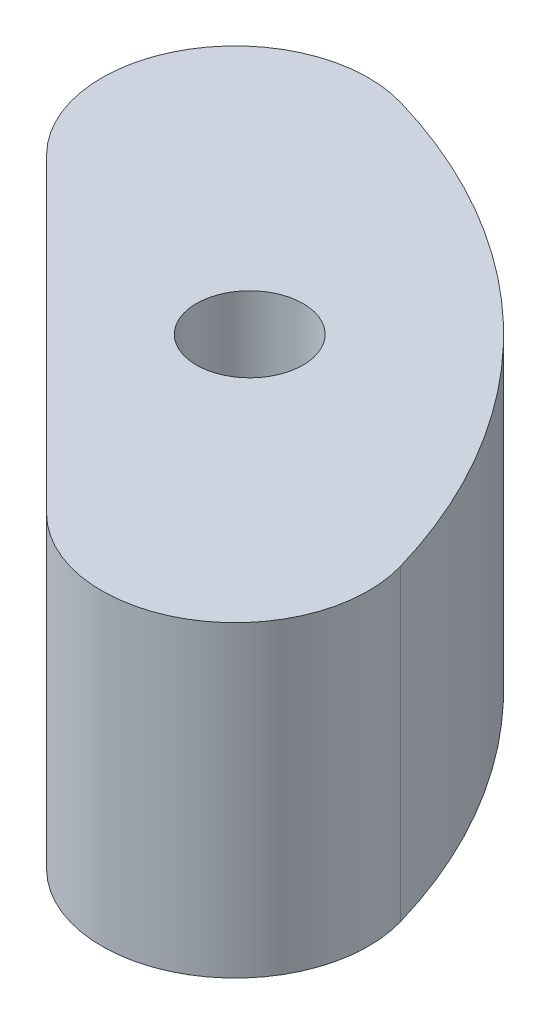
from build123d import *

# Parameters (mm, degrees)
SKETCH2_R           = 3.302
BOSS_EXTRUDE2_DEPTH = 9.525
SKETCH4_R           = 1.950000037
CUT_EXTRUDE2_DEPTH  = 5.800000084
FILLET1_R           = 8.255


with BuildPart() as part:
    # Sketch2 → Boss-Extrude2 (new, symmetric)
    with BuildSketch(Plane(origin=(0, 0, 0), x_dir=(1, 0, 0), z_dir=(0, 1, 0))):
        with BuildLine():
            Line((-11.353721197, 34.702387112), (34.702387112, -11.353721197))
            ThreePointArc((34.702387112, -11.353721197), (25.818236348, 25.818236348), (-11.353721197, 34.702387112))
        make_face()
        with Locations((17.960512242, 17.960512242)):
            Circle(SKETCH2_R, mode=Mode.SUBTRACT)
    extrude(amount=BOSS_EXTRUDE2_DEPTH, both=True)

    # Sketch4 → Cut-Extrude2 (cut)
    with BuildSketch(Plane(origin=(11.674332957, 0, -11.674332957), x_dir=(0.7071067811865476, 0, 0.7071067811865475), z_dir=(-0.7071067811865475, 0, 0.7071067811865476))):
        with Locations((9.969999999, 6.249999946)):
            Circle(SKETCH4_R)
        with Locations((-9.969999999, 6.249999946)):
            Circle(SKETCH4_R)
        with Locations((-9.969999999, -6.249999946)):
            Circle(SKETCH4_R)
        with Locations((9.969999999, -6.249999946)):
            Circle(SKETCH4_R)
    extrude(amount=-CUT_EXTRUDE2_DEPTH, mode=Mode.SUBTRACT)

    # Fillet1
    fillet1_edges = [part.edges().sort_by_distance(p)[0] for p in [
        (34.702387112, 0, 11.353721197),
        (-11.353721197, 0, -34.702387112),
    ]]
    fillet(fillet1_edges, radius=FILLET1_R)


solid = part.part
